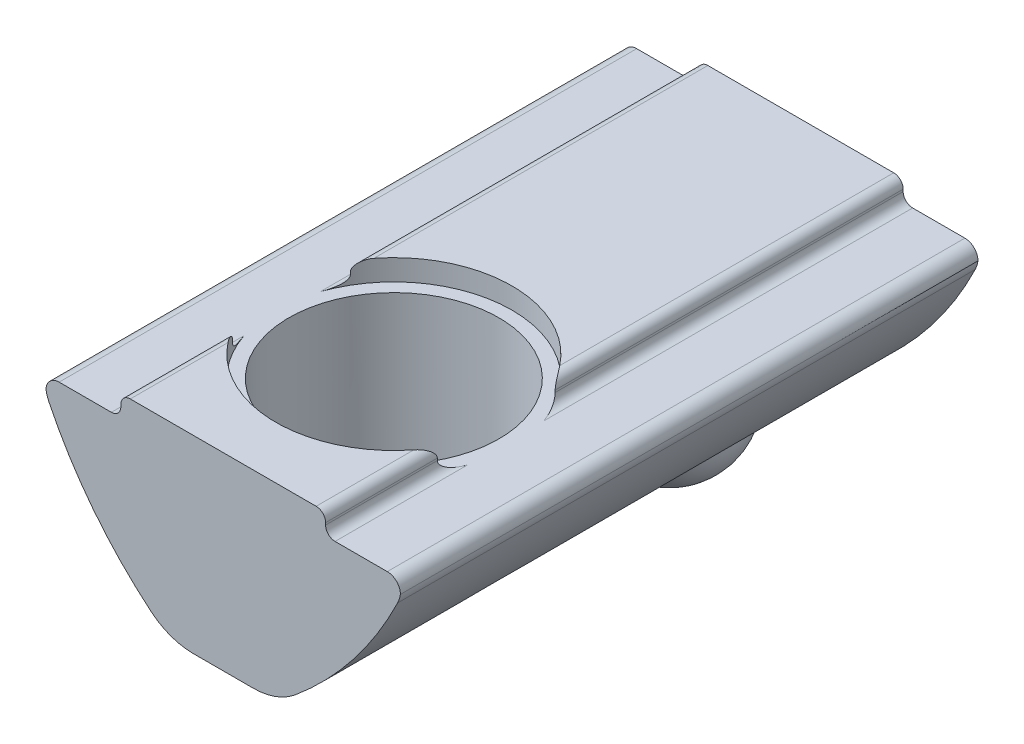
from build123d import *

# Parameters (mm, degrees)
SKETCH1_R           = 4
BOSS_EXTRUDE1_DEPTH = 16
CUT_SWEEP1_PITCH    = 1.25
SKETCH4_OUTSIDE_W   = 16.42
SKETCH4_OUTSIDE_H   = 16.42
SKETCH4_OUTSIDE_R   = 3.052784715
CUT_EXTRUDE1_DEPTH  = 1.25
CUT_EXTRUDE1_DRAFT  = -45
CUT_EXTRUDE2_DEPTH  = 3
BOSS_EXTRUDE2_START = 6.5
BOSS_EXTRUDE2_DEPTH = 22
SKETCH9_R           = 4
CUT_EXTRUDE4_DEPTH  = 24.350588956
SKETCH10_W          = 2.5
SKETCH10_H          = 6
CUT_EXTRUDE5_REACH  = 23.048
SKETCH12_R          = 4.5


with BuildPart() as part:
    # Sketch1 → Boss-Extrude1 (new body)
    with BuildSketch(Plane(origin=(0, 0, 0), x_dir=(1, 0, 0), z_dir=(0, 1, 0))):
        with Locations(Location((0, 0, 0), (0, 0, 270))):
            Circle(SKETCH1_R)
    extrude(amount=-BOSS_EXTRUDE1_DEPTH)

    # Cut-Sweep1: the profile of Sketch3 screwed along a right-hand helix of 13.8 turns, 8 arcs to a turn; built about Z, then put on its axis
    cut_sweep1_z = Axis((0, 0, 0), (0, 0, 1))
    cut_sweep1_corners = [(3.188101184, 0, -0.46875), (4.067658235, 0, 0.0390625), (4.067658235, 0, -1.1328125), (3.188101184, 0, -0.625)]
    with BuildLine(mode=Mode.PRIVATE) as cut_sweep1_profile:
        Line(cut_sweep1_corners[0], cut_sweep1_corners[1])
        Line(cut_sweep1_corners[1], cut_sweep1_corners[2])
        Line(cut_sweep1_corners[2], cut_sweep1_corners[3])
        Line(cut_sweep1_corners[3], cut_sweep1_corners[0])
    cut_sweep1_cap = Face(cut_sweep1_profile.wire())
    cut_sweep1_turn_angles = [0, 22.5, 45, 67.5, 90, 112.5, 135, 157.5, 180, 202.5, 225, 247.5, 270, 292.5, 315, 337.5, 360]
    cut_sweep1_turn_weights = [1, 0.9238795325112867, 1, 0.9238795325112867, 1, 0.9238795325112867, 1, 0.9238795325112867, 1, 0.9238795325112867, 1, 0.9238795325112867, 1, 0.9238795325112867, 1, 0.9238795325112867, 1]
    cut_sweep1_turn_rails = [Edge.make_bspline([Vector(p[0], p[1], 0).rotate(cut_sweep1_z, cut_sweep1_turn_angles[k]) / cut_sweep1_turn_weights[k] + Vector(0, 0, p[2] + CUT_SWEEP1_PITCH * cut_sweep1_turn_angles[k] / 360) for k in range(17)], [0, 0, 0, 1, 1, 2, 2, 3, 3, 4, 4, 5, 5, 6, 6, 7, 7, 8, 8, 8], 2, cut_sweep1_turn_weights) for p in cut_sweep1_corners]
    cut_sweep1_turn_sides = [Face.make_surface_from_curves(cut_sweep1_turn_rails[p[0]], cut_sweep1_turn_rails[p[1]]) for p in [(0, 1), (1, 2), (2, 3), (3, 0)]]
    cut_sweep1_last_angles = [4680, 4702.5, 4725, 4747.5, 4770, 4792.5, 4815, 4837.5, 4860, 4882.5, 4905, 4927.5, 4950, 4959, 4968]
    cut_sweep1_last_weights = [1, 0.9238795325112867, 1, 0.9238795325112867, 1, 0.9238795325112867, 1, 0.9238795325112867, 1, 0.9238795325112867, 1, 0.9238795325112867, 1, 0.9876883405951427, 1]
    cut_sweep1_last_rails = [Edge.make_bspline([Vector(p[0], p[1], 0).rotate(cut_sweep1_z, cut_sweep1_last_angles[k]) / cut_sweep1_last_weights[k] + Vector(0, 0, p[2] + CUT_SWEEP1_PITCH * cut_sweep1_last_angles[k] / 360) for k in range(15)], [0, 0, 0, 1, 1, 2, 2, 3, 3, 4, 4, 5, 5, 6, 6, 7, 7, 7], 2, cut_sweep1_last_weights) for p in cut_sweep1_corners]
    cut_sweep1_last_sides = [Face.make_surface_from_curves(cut_sweep1_last_rails[p[0]], cut_sweep1_last_rails[p[1]]) for p in [(0, 1), (1, 2), (2, 3), (3, 0)]]
    cut_sweep1 = Plane(origin=(0, -16, 0), x_dir=(0, 0, -1), z_dir=(0, 1, 0)) * Solid(Shell([*[p.moved(Location((0, 0, CUT_SWEEP1_PITCH * i))) for i in range(13) for p in cut_sweep1_turn_sides], *cut_sweep1_last_sides, cut_sweep1_cap, cut_sweep1_cap.rotate(cut_sweep1_z, 4968).moved(Location((0, 0, CUT_SWEEP1_PITCH * 4968 / 360)))]))
    add(cut_sweep1, mode=Mode.SUBTRACT)


with BuildPart() as cut_extrude1_tool:
    # Sketch4 outside → Cut-Extrude1 (with draft: the straight prism first)
    with BuildSketch(Plane.XZ.offset(16)):
        Rectangle(SKETCH4_OUTSIDE_W, SKETCH4_OUTSIDE_H)
        Circle(SKETCH4_OUTSIDE_R, mode=Mode.SUBTRACT)
    extrude(amount=-CUT_EXTRUDE1_DEPTH)
    # Cut-Extrude1: the draft: its side faces are tilted about the plane it starts from
    cut_extrude1_sides = [cut_extrude1_tool.faces().sort_by_distance(p)[0] for p in [
        (0, -15.375, -8.21),
        (8.21, -15.375, 0),
        (0, -15.375, 8.21),
        (-8.21, -15.375, 0),
        (-3.052784715, -15.375, 0),
    ]]
    draft(cut_extrude1_sides, Plane.XZ.offset(16), CUT_EXTRUDE1_DRAFT)


with BuildPart() as part_1:
    add(part.part)

    # Cut-Extrude1: cut by cut_extrude1_tool
    add(cut_extrude1_tool.part, mode=Mode.SUBTRACT)

    # Sketch5 → Revolve1 (revolve)
    with BuildSketch(Plane.XY, mode=Mode.PRIVATE) as revolve1_sk:
        with BuildLine():
            Line((0, 4.4), (0, 0))
            Line((0, 0), (-7, 0))
            Line((-7, 0), (-7, 1.1))
            ThreePointArc((-7, 1.1), (-5.74216858, 2.970153254), (-4, 4.4))
            Line((-4, 4.4), (0, 4.4))
        make_face()
    revolve(revolve1_sk.sketch.rotate(Axis((0, 0, 0), (0, -1, 0)), 90), axis=Axis((0, 0, 0), (0, -1, 0)))

    # Sketch6 → Cut-Extrude2 (cut)
    with BuildSketch(Plane(origin=(0, 4.4, 0), x_dir=(1, 0, 0), z_dir=(0, 1, 0))):
        Polygon((0, 2.886751346), (-2.5, 1.443375673), (-2.5, -1.443375673), (0, -2.886751346), (2.5, -1.443375673), (2.5, 1.443375673), align=None)
    extrude(amount=-CUT_EXTRUDE2_DEPTH, mode=Mode.SUBTRACT)

    # Cut-Extrude3 cone 1 section (through the dimple's axis) → Cut-Extrude3 (revolve, cut)
    with BuildSketch(Plane(origin=(0, 4.4, 0), x_dir=(0, 0, 1), z_dir=(1, 0, 0))):
        Polygon((0, 0), (2.886751346, 0), (0, 2.886751346), align=None)
    revolve(axis=Axis((0, 4.4, 0), (0, -1, 0)), mode=Mode.SUBTRACT)


with BuildPart() as body_2:
    # Sketch8 → Boss-Extrude2 (new body)
    with BuildSketch(Plane.XY.offset(BOSS_EXTRUDE2_START)):
        with BuildLine():
            Line((-1.141910018, -15.2), (1.141910018, -15.2))
            ThreePointArc((1.141910018, -15.2), (1.992150427, -15.050976658), (2.741026302, -14.621672998))
            ThreePointArc((2.741026302, -14.621672998), (4.957086228, -12.338580682), (6.641744362, -9.639440246))
            ThreePointArc((6.641744362, -9.639440246), (6.708027965, -9.473596894), (6.75, -9.3))
            ThreePointArc((6.75, -9.3), (6.603553391, -8.946446609), (6.25, -8.8))
            Line((6.25, -8.8), (4.26, -8.8))
            ThreePointArc((4.26, -8.8), (4.005441559, -8.694558441), (3.9, -8.44))
            Line((3.9, -8.44), (3.9, -8.36))
            ThreePointArc((3.9, -8.36), (3.794558441, -8.105441559), (3.54, -8))
            Line((3.54, -8), (-3.54, -8))
            ThreePointArc((-3.54, -8), (-3.794558441, -8.105441559), (-3.9, -8.36))
            Line((-3.9, -8.36), (-3.9, -8.44))
            ThreePointArc((-3.9, -8.44), (-4.005441559, -8.694558441), (-4.26, -8.8))
            Line((-4.26, -8.8), (-6.25, -8.8))
            ThreePointArc((-6.25, -8.8), (-6.603553391, -8.946446609), (-6.75, -9.3))
            ThreePointArc((-6.75, -9.3), (-6.708027965, -9.473596894), (-6.641744362, -9.639440246))
            ThreePointArc((-6.641744362, -9.639440246), (-4.957086228, -12.338580682), (-2.741026302, -14.621672998))
            ThreePointArc((-2.741026302, -14.621672998), (-1.992150427, -15.050976658), (-1.141910018, -15.2))
        make_face()
    extrude(amount=-BOSS_EXTRUDE2_DEPTH)

    # Sketch9 → Cut-Extrude4 (cut, through all)
    with BuildSketch(Plane(origin=(0, 0, 0), x_dir=(1, 0, 0), z_dir=(0, 1, 0))):
        with Locations(Location((0, 0, 0), (0, 0, 286.587393433))):
            Circle(SKETCH9_R)
    extrude(amount=-CUT_EXTRUDE4_DEPTH, mode=Mode.SUBTRACT)

    # Sketch10 → Cut-Revolve1 (revolve, cut)
    with BuildSketch(Plane(origin=(0, 0, 0), x_dir=(0, 0, -1), z_dir=(1, 0, 0))):
        with Locations((11.75, -12.2)):
            Rectangle(SKETCH10_W, SKETCH10_H)
    revolve(axis=Axis((0, -9.2, -10.5), (0, 1, 0)), mode=Mode.SUBTRACT)

    # Cut-Extrude5: up to this face of the body (flat: up to its plane)
    cut_extrude5_end = Plane(body_2.part.faces().sort_by_distance((5.255, -8.8, -4.5))[0])
    # Sketch12 → Cut-Extrude5 (cut, up to the picked face)
    with BuildSketch(Plane(origin=(0, -8, 0), x_dir=(1, 0, 0), z_dir=(0, 1, 0)), mode=Mode.PRIVATE) as cut_extrude5_sk1:
        Circle(SKETCH12_R)
    cut_extrude5_tool1 = split(extrude(cut_extrude5_sk1.sketch, amount=-CUT_EXTRUDE5_REACH, mode=Mode.PRIVATE), bisect_by=cut_extrude5_end, keep=Keep.BOTH, mode=Mode.PRIVATE)
    add(cut_extrude5_tool1.solids().sort_by(Axis((0, -8, 0), (0, -1, 0)))[0], mode=Mode.SUBTRACT)


with BuildPart() as body_3:
    # Sketch11 → Revolve2 (revolve)
    with BuildSketch(Plane(origin=(0, 0, 0), x_dir=(0, 0, -1), z_dir=(1, 0, 0))):
        with BuildLine():
            Line((10.5, -12.1), (10.5, -17.1))
            ThreePointArc((10.5, -17.1), (13, -14.6), (10.5, -12.1))
        make_face()
    revolve(axis=Axis((0, -12.1, -10.5), (0, -1, 0)))


solid = Compound([body_2.part, body_3.part])
